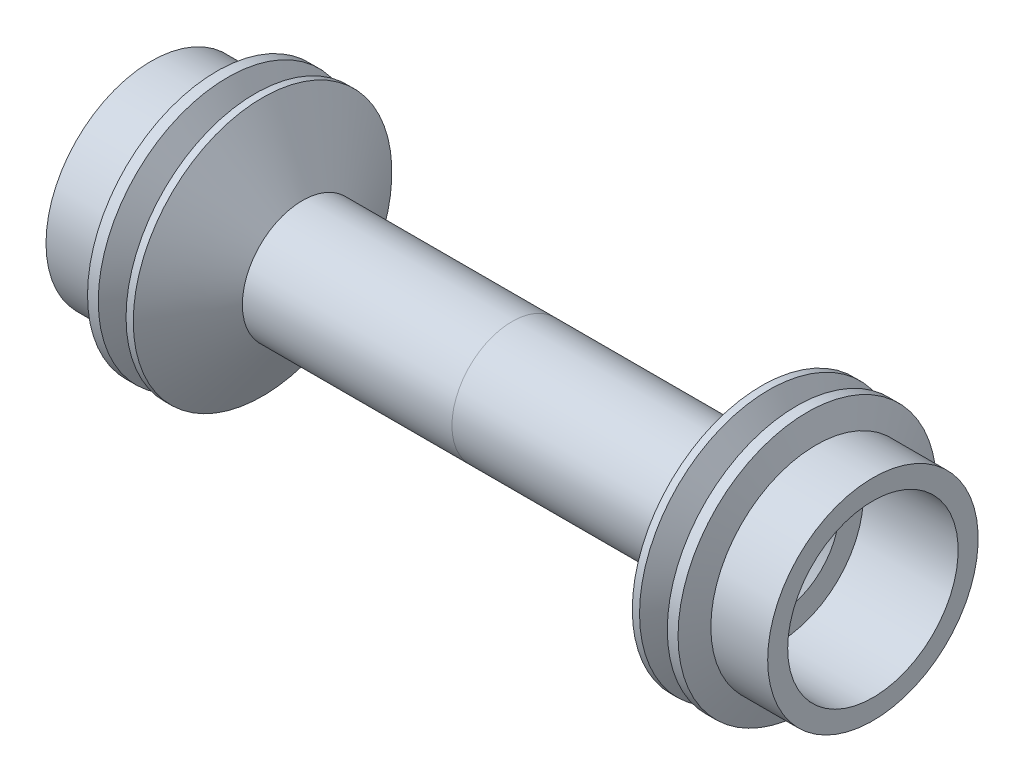
from build123d import *

# Parameters (mm, degrees)
CHAMFER1_SIZE = 0.508


with BuildPart() as part:
    # Sketch2 → Revolve1 (revolve)
    with BuildSketch(Plane.XY):
        Polygon((-16.05, 5.55625), (-19.05, 5.55625), (-19.05, 4.5), (-14.05, 4.5), (-14.05, 3.23), (-13.542, 2.722), (-13.542, 1.7145), (-9.225, 1.7145), (-9.225, 0), (-8.1, 0), (-6.5, 1.6), (0, 1.6), (0, 3.175), (-11.065214988, 3.175), (-13.173265158, 6.82625), (-13.554265158, 6.82625), (-14.2875, 5.55625), (-15.020734842, 6.82625), (-15.587757802, 6.82625), align=None)
    revolve(axis=Axis((-19.05, 0, 0), (1, 0, 0)))


with BuildPart() as body_2:
    # Mirror1: mirrored copy
    add(part.part.mirror(Plane(origin=(0, 0, 0), x_dir=(0, 0, 1), z_dir=(1, 0, 0))))


with BuildPart() as part_1:
    add(part.part)

    # Chamfer1
    chamfer1_edges = [part_1.edges().sort_by_distance(p)[0] for p in [
        (-19.05, -4.5, 0),
    ]]
    chamfer(chamfer1_edges, length=CHAMFER1_SIZE)


solid = Compound([body_2.part, part_1.part])
